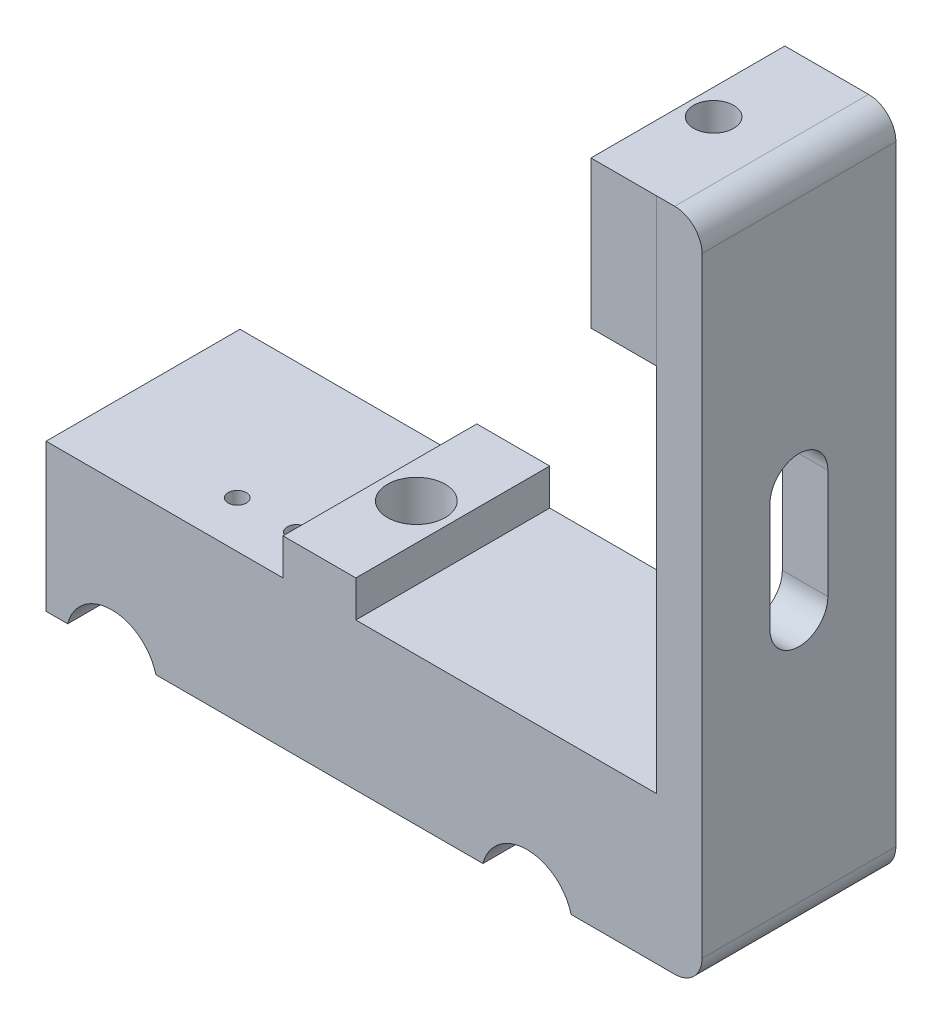
from build123d import *

# Parameters (mm, degrees)
BOSS_EXTRUDE1_DEPTH     = 10.8
BOSS_EXTRUDE2_DEPTH     = 10.64
CUT_EXTRUDE1_DEPTH      = 39.168054705
CUT_EXTRUDE1_DEPTH_BACK = 39.168054705
SKETCH5_R               = 5
FILLET1_R               = 1
SKETCH6_W               = 21.28
SKETCH6_H               = 16.18
BOSS_EXTRUDE3_DEPTH     = 12
SKETCH7_W               = 5
SKETCH7_H               = 21.281328743
BOSS_EXTRUDE4_DEPTH     = 56.83
SKETCH8_W               = 21.284331222
SKETCH8_H               = 16.18
BOSS_EXTRUDE5_DEPTH     = 7.19
FILLET3_R               = 3
SKETCH9_R               = 2.2
CUT_EXTRUDE2_DEPTH      = 85.918196519
SKETCH10_R              = 3.175
CUT_EXTRUDE3_DEPTH      = 85.918196519
SKETCH11_W              = 24.977296572
SKETCH11_H              = 9.721484234
CUT_EXTRUDE4_DEPTH      = 71.220021919
CUT_EXTRUDE5_REACH      = 86.898
CUT_EXTRUDE6_DEPTH      = 90.46728118


with BuildPart() as part:
    # Sketch2 → Boss-Extrude1 (new body)
    with BuildSketch(Plane.XY):
        Polygon((10.1, 0), (10.1, 1.709943763), (6.25480432, 7), (-6.25480432, 7), (-10.1, 1.709943763), (-10.1, 0), align=None)
    extrude(amount=BOSS_EXTRUDE1_DEPTH)

    # Sketch4 → Boss-Extrude2 (add, symmetric)
    with BuildSketch(Plane.XY):
        Polygon((-4, 0), (-4, -4.8), (-30, -4.8), (-30, -20.98), (30, -20.98), (30, -4.8), (4, -4.8), (4, 0), align=None)
    extrude(amount=BOSS_EXTRUDE2_DEPTH, both=True)

    # Sketch5 → Cut-Extrude1 (cut, two sides: drawn at the far end of the back side and taken through both)
    with BuildSketch(Plane.XY.offset(-CUT_EXTRUDE1_DEPTH_BACK)):
        with Locations((-22.790976064, -22.227391232)):
            Circle(SKETCH5_R)
        with Locations((22.790976064, -22.227391232)):
            Circle(SKETCH5_R)
    extrude(amount=CUT_EXTRUDE1_DEPTH + CUT_EXTRUDE1_DEPTH_BACK, mode=Mode.SUBTRACT)

    # Fillet1
    fillet1_edges = [part.edges().sort_by_distance(p)[0] for p in [
        (-10.1, 0, 5.4),
        (-10.1, 1.709943763, 5.4),
        (-6.25480432, 7, 5.4),
        (6.25480432, 7, 5.4),
        (10.1, 0, 5.4),
        (10.1, 1.709943763, 5.4),
    ]]
    fillet(fillet1_edges, radius=FILLET1_R)

    # Sketch6 → Boss-Extrude3 (add)
    with BuildSketch(Plane(origin=(30, 0, 0), x_dir=(0, 0, -1), z_dir=(1, 0, 0))):
        with Locations((0, -12.89)):
            Rectangle(SKETCH6_W, SKETCH6_H)
    extrude(amount=BOSS_EXTRUDE3_DEPTH)

    # Sketch7 → Boss-Extrude4 (add)
    with BuildSketch(Plane(origin=(0, -4.8, 0), x_dir=(1, 0, 0), z_dir=(0, 1, 0))):
        with Locations((39.5, 0.000664372)):
            Rectangle(SKETCH7_W, SKETCH7_H)
    extrude(amount=BOSS_EXTRUDE4_DEPTH)

    # Sketch8 → Boss-Extrude5 (add)
    with BuildSketch(Plane.ZY.offset(-37)):
        with Locations((0.000836868, 43.94)):
            Rectangle(SKETCH8_W, SKETCH8_H)
    extrude(amount=BOSS_EXTRUDE5_DEPTH)

    # Fillet3
    fillet3_edges = [part.edges().sort_by_distance(p)[0] for p in [
        (42, 52.03, -0.000664372),
        (42, -20.98, 0),
    ]]
    fillet(fillet3_edges, radius=FILLET3_R)

    # Sketch9 → Cut-Extrude2 (cut, through all)
    with BuildSketch(Plane.XZ.offset(20.98)):
        with Locations((32.632878078, 0)):
            Circle(SKETCH9_R)
    extrude(amount=-CUT_EXTRUDE2_DEPTH, mode=Mode.SUBTRACT)

    # Sketch10 → Cut-Extrude3 (cut, through all)
    with BuildSketch(Plane.XZ.offset(20.98)):
        with Locations((0.000925951, 0)):
            Circle(SKETCH10_R)
    extrude(amount=-CUT_EXTRUDE3_DEPTH, mode=Mode.SUBTRACT)

    # Sketch11 → Cut-Extrude4 (cut, through all)
    with BuildSketch(Plane.XY.offset(10.8)):
        with Locations((-0.121132817, 4.060742117)):
            Rectangle(SKETCH11_W, SKETCH11_H)
    extrude(amount=-CUT_EXTRUDE4_DEPTH, mode=Mode.SUBTRACT)

    # Sketch12 → Cut-Extrude5 (cut, up to next)
    with BuildSketch(Plane.XZ.offset(20.98), mode=Mode.PRIVATE) as cut_extrude5_sk1:
        with BuildLine():
            ThreePointArc((-8.626172213, 5.53800248), (-7.626172213, 4.53800248), (-6.626172213, 5.53800248))
            ThreePointArc((-6.626172213, 5.53800248), (-7.626172213, 6.53800248), (-8.626172213, 5.53800248))
        make_face()
    cut_extrude5_tool1 = extrude(cut_extrude5_sk1.sketch, amount=-CUT_EXTRUDE5_REACH, mode=Mode.PRIVATE) & part.part
    # Sketch12 → Cut-Extrude5 (cut, up to next)
    with BuildSketch(Plane.XZ.offset(20.98), mode=Mode.PRIVATE) as cut_extrude5_sk2:
        with BuildLine():
            ThreePointArc((-15.126172213, 5.53800248), (-14.126172213, 4.53800248), (-13.126172213, 5.53800248))
            ThreePointArc((-13.126172213, 5.53800248), (-14.126172213, 6.53800248), (-15.126172213, 5.53800248))
        make_face()
    cut_extrude5_tool2 = extrude(cut_extrude5_sk2.sketch, amount=-CUT_EXTRUDE5_REACH, mode=Mode.PRIVATE) & part.part
    add(cut_extrude5_tool1.solids().sort_by_distance((-7.626172, -20.98, 5.538002))[0], mode=Mode.SUBTRACT)
    add(cut_extrude5_tool2.solids().sort_by_distance((-14.126172, -20.98, 5.538002))[0], mode=Mode.SUBTRACT)

    # Sketch13 → Cut-Extrude6 (cut, through all)
    with BuildSketch(Plane(origin=(42, 0, 0), x_dir=(0, 0, -1), z_dir=(1, 0, 0))):
        with BuildLine():
            Line((3.175, 21.525), (3.175, 9.525))
            ThreePointArc((3.175, 9.525), (0, 6.35), (-3.175, 9.525))
            Line((-3.175, 9.525), (-3.175, 21.525))
            ThreePointArc((-3.175, 21.525), (0, 24.7), (3.175, 21.525))
        make_face()
    extrude(amount=-CUT_EXTRUDE6_DEPTH, mode=Mode.SUBTRACT)


solid = part.part
